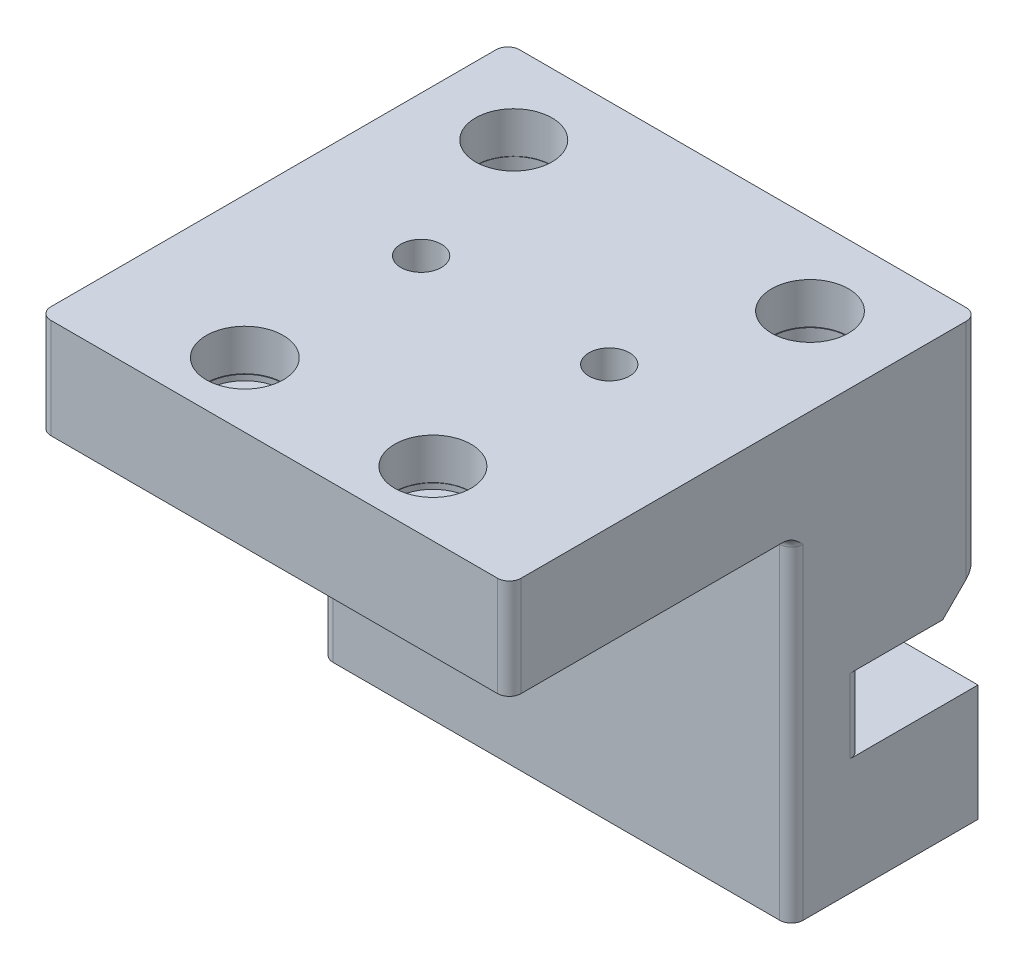
from build123d import *

# Parameters (mm, degrees)
SKETCH1_W                      = 40
SKETCH1_H                      = 22
BOSS_EXTRUDE1_DEPTH            = 5
CBORE_FOR_M3_SHCS1_AT_2_COUNT  = 2
CBORE_FOR_M3_SHCS1_AT_2_PITCH  = 16
SKETCH6_W                      = 40
SKETCH6_H                      = 6
BOSS_EXTRUDE2_DEPTH            = 28.7
SKETCH7_W                      = 40
SKETCH7_H                      = 4.9
BOSS_EXTRUDE3_DEPTH            = 9.87
SKETCH8_W                      = 40
SKETCH8_H                      = 17.5
BOSS_EXTRUDE4_DEPTH            = 9.87
SKETCH18_W                     = 40
SKETCH18_H                     = 5
BOSS_EXTRUDE7_DEPTH            = 2
CBORE_FOR_M3_SHCS2_AT_2_COUNT  = 2
CBORE_FOR_M3_SHCS2_AT_2_PITCH  = 25.201777654
CHAMFER1_SIZE                  = 3
FILLET2_R                      = 1
M3_CLEARANCE_HOLE1_D           = 3.4
M3_CLEARANCE_HOLE1_CSINK_D     = 3.45
M3_CLEARANCE_HOLE1_CSINK_ANGLE = 90
FILLET3_R                      = 1
CUT_EXTRUDE1_DEPTH             = 3
BOSS_EXTRUDE6_START            = 5
BOSS_EXTRUDE6_DEPTH            = 5
BOSS_EXTRUDE8_START            = 3.5
SKETCH19_R                     = 3.275
SKETCH19_R_2                   = 3.25
SKETCH19_R_3                   = 1.725
BOSS_EXTRUDE8_DEPTH            = 3.5
BOSS_EXTRUDE9_START            = 2.5
SKETCH20_R                     = 3.25
SKETCH20_R_2                   = 1.7
BOSS_EXTRUDE9_DEPTH            = 2.5


with BuildPart() as part:
    # Sketch1 → Boss-Extrude1 (new body)
    with BuildSketch(Plane(origin=(0, 0, 0), x_dir=(1, 0, 0), z_dir=(0, 1, 0))):
        Rectangle(SKETCH1_W, SKETCH1_H)
    extrude(amount=BOSS_EXTRUDE1_DEPTH)

    # Sketch4 → CBORE for M3 SHCS1 (revolve, cut)
    with BuildSketch(Plane(origin=(8, 5, 7.5), x_dir=(0, 0, 1), z_dir=(1, 0, 0))):
        Polygon((0, 0), (0, 5), (1.7, 5), (1.7, 3), (3.25, 3), (3.25, 0.025), (3.275, 0), align=None)
    cbore_for_m3_shcs1 = revolve(axis=Axis((8, 11.35, 7.5), (0, -1, 0)), mode=Mode.SUBTRACT)

    # CBORE for M3 SHCS1 at 2: CBORE for M3 SHCS1 ×2
    with Locations(*[(-i * CBORE_FOR_M3_SHCS1_AT_2_PITCH, 0, 0) for i in range(1, CBORE_FOR_M3_SHCS1_AT_2_COUNT)]):
        add(cbore_for_m3_shcs1, mode=Mode.SUBTRACT)

    # Sketch6 → Boss-Extrude2 (add)
    with BuildSketch(Plane(origin=(0, 5, 0), x_dir=(1, 0, 0), z_dir=(0, 1, 0))):
        with Locations((0, 14)):
            Rectangle(SKETCH6_W, SKETCH6_H)
    extrude(amount=-BOSS_EXTRUDE2_DEPTH)

    # Sketch7 → Boss-Extrude3 (add)
    with BuildSketch(Plane(origin=(0, 0, -17), x_dir=(-1, 0, 0), z_dir=(0, 0, -1))):
        with Locations((0, -21.25)):
            Rectangle(SKETCH7_W, SKETCH7_H)
    extrude(amount=BOSS_EXTRUDE3_DEPTH)

    # Sketch8 → Boss-Extrude4 (add)
    with BuildSketch(Plane(origin=(0, 0, -17), x_dir=(-1, 0, 0), z_dir=(0, 0, -1))):
        with Locations((0, -3.75)):
            Rectangle(SKETCH8_W, SKETCH8_H)
    extrude(amount=BOSS_EXTRUDE4_DEPTH)

    # Sketch18 → Boss-Extrude7 (add)
    with BuildSketch(Plane.XY.offset(11)):
        with Locations((0, 2.5)):
            Rectangle(SKETCH18_W, SKETCH18_H)
    extrude(amount=BOSS_EXTRUDE7_DEPTH)

    # Sketch11 → CBORE for M3 SHCS2 (revolve, cut)
    with BuildSketch(Plane(origin=(-12.600888827, 5, -19.98), x_dir=(0, 0, 1), z_dir=(1, 0, 0))):
        Polygon((0, 0), (0, 28.7), (1.7, 28.7), (1.7, 3), (3.25, 3), (3.25, 0.025), (3.275, 0), align=None)
    cbore_for_m3_shcs2 = revolve(axis=Axis((-12.600888827, 11.35, -19.98), (0, -1, 0)), mode=Mode.SUBTRACT)

    # CBORE for M3 SHCS2 at 2: CBORE for M3 SHCS2 ×2
    with Locations(*[(i * CBORE_FOR_M3_SHCS2_AT_2_PITCH, 0, 0) for i in range(1, CBORE_FOR_M3_SHCS2_AT_2_COUNT)]):
        add(cbore_for_m3_shcs2, mode=Mode.SUBTRACT)

    # Chamfer1
    chamfer1_edges = [part.edges().sort_by_distance(p)[0] for p in [
        (0, -12.5, -26.87),
    ]]
    chamfer(chamfer1_edges, length=CHAMFER1_SIZE)

    # Fillet2
    fillet2_edges = [part.edges().sort_by_distance(p)[0] for p in [
        (20, -2.25, -26.87),
        (-20, -11.85, -11),
        (20, -11.85, -11),
        (20, -15.65, -17),
        (-20, -15.65, -17),
        (-20, -21.25, -26.87),
        (-20, -2.25, -26.87),
        (-20, 2.5, 13),
        (20, 2.5, 13),
    ]]
    fillet(fillet2_edges, radius=FILLET2_R)

    # M3 Clearance Hole1 (through all)
    with Locations(Plane(origin=(0, 5, 0), x_dir=(1, 0, 0), z_dir=(0, 1, 0))):
        with Locations((-8, 7.5), (8, 7.5)):
            CounterSinkHole(M3_CLEARANCE_HOLE1_D / 2, M3_CLEARANCE_HOLE1_CSINK_D / 2, counter_sink_angle=M3_CLEARANCE_HOLE1_CSINK_ANGLE)

    # Fillet3
    # the kernel refuses this fillet: 1 mm, written as the material it adds along each edge
    with BuildSketch(Plane(origin=(19, 0, -11), x_dir=(0, -1, 0), z_dir=(-1, 0, 0))) as fillet3_piece_1:
        with BuildLine():
            CenterArc((FILLET3_R, FILLET3_R), FILLET3_R, 180, 90)
            Line((0, FILLET3_R), (0, 0))
            Line((0, 0), (FILLET3_R, 0))
        make_face()
    extrude(amount=38)
    with BuildSketch(Plane(origin=(-19, 0, -12), x_dir=(0, 0, 1), z_dir=(1, 0, 0))) as fillet3_piece_2_section:
        with BuildLine():
            CenterArc((1 + FILLET3_R, FILLET3_R), FILLET3_R, 180, 90)
            Line((1 + FILLET3_R, 0), (1, 0))
            Line((1, 0), (1, FILLET3_R))
        make_face()
    fillet3_piece_2 = revolve(axis=Axis((-19, 0, -12), (0, -1, 0)), revolution_arc=233.296989237, mode=Mode.PRIVATE)
    fillet3_piece_2 = split(fillet3_piece_2, bisect_by=Plane(origin=(-20, -0.311628018, -11.250060985), z_dir=(1, 0, 0)), keep=Keep.TOP, mode=Mode.PRIVATE)
    add(fillet3_piece_2)
    with BuildSketch(Plane(origin=(19, 0, -12), x_dir=(-0.8017442392976477, 0, -0.5976672776328282), z_dir=(-0.5976672776328282, 0, 0.8017442392976477))) as fillet3_piece_3_section:
        with BuildLine():
            CenterArc((1 + FILLET3_R, FILLET3_R), FILLET3_R, 180, 90)
            Line((1, FILLET3_R), (1, 0))
            Line((1, 0), (1 + FILLET3_R, 0))
        make_face()
    fillet3_piece_3 = revolve(axis=Axis((19, 0, -12), (0, -1, 0)), revolution_arc=233.296989237, mode=Mode.PRIVATE)
    fillet3_piece_3 = split(fillet3_piece_3, bisect_by=Plane(origin=(20, -0.31162852, -11.250061149), z_dir=(-1, 0, 0)), keep=Keep.TOP, mode=Mode.PRIVATE)
    add(fillet3_piece_3)

    # Sketch15 → Cut-Extrude1 (cut)
    with BuildSketch(Plane.XZ.offset(23.7)):
        Polygon((15.900888827, -19.98), (14.250888827, -17.122116168), (10.950888827, -17.122116168), (9.300888827, -19.98), (10.950888827, -22.837883832), (14.250888827, -22.837883832), align=None)
        Polygon((-9.300888827, -19.98), (-10.950888827, -17.122116168), (-14.250888827, -17.122116168), (-15.900888827, -19.98), (-14.250888827, -22.837883832), (-10.950888827, -22.837883832), align=None)
    extrude(amount=-CUT_EXTRUDE1_DEPTH, mode=Mode.SUBTRACT)

    # Sketch16 → Boss-Extrude6 (add)
    with BuildSketch(Plane.XZ.offset(23.7).offset(BOSS_EXTRUDE6_START)):
        with BuildLine():
            Line((19, -11), (-19, -11))
            ThreePointArc((-19, -11), (-19.707106781, -11.292893219), (-20, -12))
            Line((-20, -12), (-20, -25.87))
            ThreePointArc((-20, -25.87), (-19.707106781, -26.577106781), (-19, -26.87))
            Line((-19, -26.87), (20, -26.87))
            Line((20, -26.87), (20, -12))
            ThreePointArc((20, -12), (19.707106781, -11.292893219), (19, -11))
        make_face()
        Polygon((10.950888827, -22.837883832), (14.250888827, -22.837883832), (15.900888827, -19.98), (14.250888827, -17.122116168), (10.950888827, -17.122116168), (9.300888827, -19.98), align=None, mode=Mode.SUBTRACT)
        Polygon((-10.950888827, -22.837883832), (-9.300888827, -19.98), (-10.950888827, -17.122116168), (-14.250888827, -17.122116168), (-15.900888827, -19.98), (-14.250888827, -22.837883832), align=None, mode=Mode.SUBTRACT)
    extrude(amount=-BOSS_EXTRUDE6_DEPTH)

    # Sketch19 → Boss-Extrude8 (add)
    with BuildSketch(Plane(origin=(0, 5, 0), x_dir=(1, 0, 0), z_dir=(0, 1, 0)).offset(BOSS_EXTRUDE8_START)):
        with BuildLine():
            Line((-19, -13), (19, -13))
            ThreePointArc((19, -13), (19.707106781, -12.707106781), (20, -12))
            Line((20, -12), (20, 25.87))
            ThreePointArc((20, 25.87), (19.707106781, 26.577106781), (19, 26.87))
            Line((19, 26.87), (-19, 26.87))
            ThreePointArc((-19, 26.87), (-19.707106781, 26.577106781), (-20, 25.87))
            Line((-20, 25.87), (-20, -12))
            ThreePointArc((-20, -12), (-19.707106781, -12.707106781), (-19, -13))
        make_face()
        with Locations(Location((-8, -7.5, 0), (0, 0, 270))):
            Circle(SKETCH19_R, mode=Mode.SUBTRACT)
        with Locations(Location((8, -7.5, 0), (0, 0, 270))):
            Circle(SKETCH19_R_2, mode=Mode.SUBTRACT)
        with Locations(Location((8, 7.5, 0), (0, 0, 270))):
            Circle(SKETCH19_R_3, mode=Mode.SUBTRACT)
        with Locations(Location((-8, 7.5, 0), (0, 0, 270))):
            Circle(SKETCH19_R_3, mode=Mode.SUBTRACT)
        with Locations(Location((-12.600888827, 19.98, 0), (0, 0, 270))):
            Circle(SKETCH19_R_2, mode=Mode.SUBTRACT)
        with Locations(Location((12.600888827, 19.98, 0), (0, 0, 270))):
            Circle(SKETCH19_R, mode=Mode.SUBTRACT)
    extrude(amount=-BOSS_EXTRUDE8_DEPTH)

    # Sketch20 → Boss-Extrude9 (add)
    # profile 1 of 2: a face of its own
    with BuildSketch(Plane(origin=(0, 2, 0), x_dir=(1, 0, 0), z_dir=(0, 1, 0)).offset(BOSS_EXTRUDE9_START)):
        with Locations(Location((-8, -7.5, 0), (0, 0, 270))):
            Circle(SKETCH20_R)
        with Locations(Location((-8, -7.5, 0), (0, 0, 270))):
            Circle(SKETCH20_R_2, mode=Mode.SUBTRACT)
    # profile 2 of 2: a face of its own
    with BuildSketch(Plane(origin=(0, 2, 0), x_dir=(1, 0, 0), z_dir=(0, 1, 0)).offset(BOSS_EXTRUDE9_START)):
        with Locations(Location((8, -7.5, 0), (0, 0, 270))):
            Circle(SKETCH20_R)
        with Locations(Location((8, -7.5, 0), (0, 0, 270))):
            Circle(SKETCH20_R_2, mode=Mode.SUBTRACT)
    extrude(amount=-BOSS_EXTRUDE9_DEPTH)


solid = part.part
